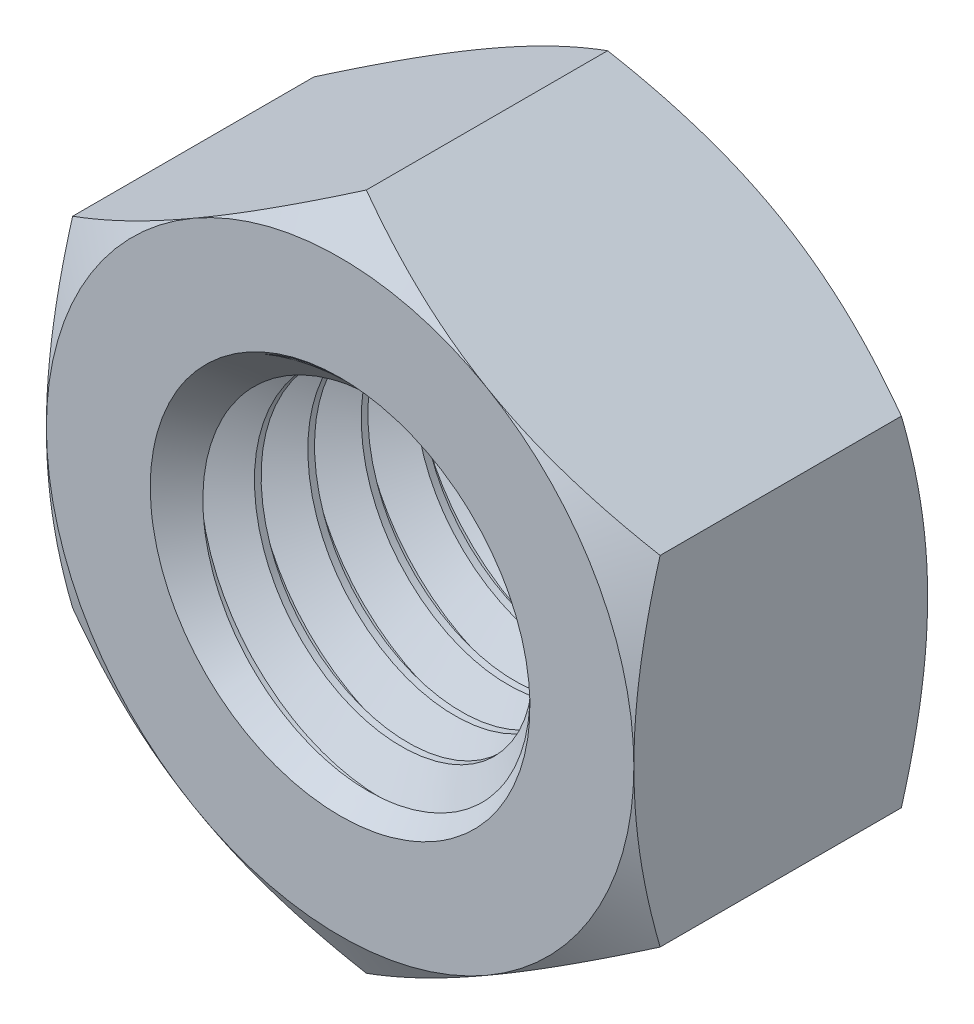
from build123d import *

# Parameters (mm, degrees)
BOSS_EXTRUDE1_DEPTH      = 2.75
BOSS_EXTRUDE1_DEPTH_BACK = 2.75
SKETCH2_R                = 3.5
SKETCH3_OUTSIDE_W        = 54.786
SKETCH3_OUTSIDE_H        = 56.488
SKETCH3_OUTSIDE_R        = 5.5
CUT_EXTRUDE1_DEPTH       = 11.041580221
CUT_EXTRUDE1_DRAFT       = -60
MIRROR1_COPY_1_SKETCH_W  = 54.786
MIRROR1_COPY_1_SKETCH_H  = 56.488
MIRROR1_COPY_1_SKETCH_R  = 5.5
MIRROR1_COPY_1_DEPTH     = 11.041580221
MIRROR1_COPY_1_DRAFT     = -60
SWEEP1_PITCH             = 1
SKETCH6_R                = 3.554126588
CUT_EXTRUDE2_DEPTH       = 11.641454896
SKETCH7_R                = 3.554126588
CUT_EXTRUDE3_DEPTH       = 11.04158033


with BuildPart() as part:
    # Sketch2 → Boss-Extrude1 (new, two sides: drawn at the far end of the back side and taken through both)
    with BuildSketch(Plane.XY.offset(-BOSS_EXTRUDE1_DEPTH_BACK)):
        Polygon((0, 6.350852961), (-5.5, 3.175426481), (-5.5, -3.175426481), (0, -6.350852961), (5.5, -3.175426481), (5.5, 3.175426481), align=None)
        Circle(SKETCH2_R, mode=Mode.SUBTRACT)
    extrude(amount=BOSS_EXTRUDE1_DEPTH + BOSS_EXTRUDE1_DEPTH_BACK)


with BuildPart() as cut_extrude1_tool:
    # Sketch3 outside → Cut-Extrude1 (with draft: the straight prism first)
    with BuildSketch(Plane.XY.offset(2.75)):
        Rectangle(SKETCH3_OUTSIDE_W, SKETCH3_OUTSIDE_H)
        Circle(SKETCH3_OUTSIDE_R, mode=Mode.SUBTRACT)
    extrude(amount=-CUT_EXTRUDE1_DEPTH)
    # Cut-Extrude1: the draft: its side faces are tilted about the plane it starts from
    cut_extrude1_sides = [cut_extrude1_tool.faces().sort_by_distance(p)[0] for p in [
        (0, -28.244, -2.77079011),
        (27.393, 0, -2.77079011),
        (0, 28.244, -2.77079011),
        (-27.393, 0, -2.77079011),
        (-5.5, 0, -2.77079011),
    ]]
    draft(cut_extrude1_sides, Plane.XY.offset(2.75), CUT_EXTRUDE1_DRAFT)


with BuildPart() as part_1:
    add(part.part)

    # Cut-Extrude1: cut by cut_extrude1_tool
    add(cut_extrude1_tool.part, mode=Mode.SUBTRACT)


with BuildPart() as mirror1_copy_1_tool:
    # Mirror1 copy 1 sketch → Mirror1 copy 1 (with draft: the straight prism first)
    with BuildSketch(Plane(origin=(0, 0, -2.75), x_dir=(1, 0, 0), z_dir=(0, 0, -1))):
        Rectangle(MIRROR1_COPY_1_SKETCH_W, MIRROR1_COPY_1_SKETCH_H)
        Circle(MIRROR1_COPY_1_SKETCH_R, mode=Mode.SUBTRACT)
    extrude(amount=-MIRROR1_COPY_1_DEPTH)
    # Mirror1 copy 1: the draft: its side faces are tilted about the plane it starts from
    mirror1_copy_1_sides = [mirror1_copy_1_tool.faces().sort_by_distance(p)[0] for p in [
        (0, -28.244, 2.77079011),
        (27.393, 0, 2.77079011),
        (0, 28.244, 2.77079011),
        (-27.393, 0, 2.77079011),
        (-5.5, 0, 2.77079011),
    ]]
    draft(mirror1_copy_1_sides, Plane(origin=(0, 0, -2.75), x_dir=(1, 0, 0), z_dir=(0, 0, -1)), MIRROR1_COPY_1_DRAFT)


with BuildPart() as part_2:
    add(part_1.part)

    # Mirror1 copy 1: cut by mirror1_copy_1_tool
    add(mirror1_copy_1_tool.part, mode=Mode.SUBTRACT)

    # Sweep1: arcs per turn and ends read off the stored shape
    # Sweep1: the profile of Sketch4 screwed along a right-hand helix through 6.5 turns, 8 arcs to a turn; built about Z, then put on its axis
    sweep1_z = Axis((0, 0, 0), (0, 0, 1))
    sweep1_corners = [(3.554126588, 0, -0.90625), (2.850480947, 0, -0.5), (2.850480947, 0, -0.375), (3.554126588, 0, 0.03125)]
    with BuildLine(mode=Mode.PRIVATE) as sweep1_profile:
        Line(sweep1_corners[0], sweep1_corners[1])
        Line(sweep1_corners[1], sweep1_corners[2])
        Line(sweep1_corners[2], sweep1_corners[3])
        Line(sweep1_corners[3], sweep1_corners[0])
    sweep1_cap = Face(sweep1_profile.wire())
    sweep1_turn_angles = [0, 22.5, 45, 67.5, 90, 112.5, 135, 157.5, 180, 202.5, 225, 247.5, 270, 292.5, 315, 337.5, 360]
    sweep1_turn_weights = [1, 0.9238795325112867, 1, 0.9238795325112867, 1, 0.9238795325112867, 1, 0.9238795325112867, 1, 0.9238795325112867, 1, 0.9238795325112867, 1, 0.9238795325112867, 1, 0.9238795325112867, 1]
    sweep1_turn_rails = [Edge.make_bspline([Vector(p[0], p[1], 0).rotate(sweep1_z, sweep1_turn_angles[k]) / sweep1_turn_weights[k] + Vector(0, 0, p[2] + SWEEP1_PITCH * sweep1_turn_angles[k] / 360) for k in range(17)], [0, 0, 0, 1, 1, 2, 2, 3, 3, 4, 4, 5, 5, 6, 6, 7, 7, 8, 8, 8], 2, sweep1_turn_weights) for p in sweep1_corners]
    sweep1_turn_sides = [Face.make_surface_from_curves(sweep1_turn_rails[p[0]], sweep1_turn_rails[p[1]]) for p in [(0, 1), (1, 2), (2, 3), (3, 0)]]
    sweep1_last_angles = [2160, 2182.5, 2205, 2227.5, 2250, 2272.5, 2295, 2317.5, 2340]
    sweep1_last_weights = [1, 0.9238795325112867, 1, 0.9238795325112867, 1, 0.9238795325112867, 1, 0.9238795325112062, 1]
    sweep1_last_rails = [Edge.make_bspline([Vector(p[0], p[1], 0).rotate(sweep1_z, sweep1_last_angles[k]) / sweep1_last_weights[k] + Vector(0, 0, p[2] + SWEEP1_PITCH * sweep1_last_angles[k] / 360) for k in range(9)], [0, 0, 0, 1, 1, 2, 2, 3, 3, 4, 4, 4], 2, sweep1_last_weights) for p in sweep1_corners]
    sweep1_last_sides = [Face.make_surface_from_curves(sweep1_last_rails[p[0]], sweep1_last_rails[p[1]]) for p in [(0, 1), (1, 2), (2, 3), (3, 0)]]
    sweep1 = Plane(origin=(0, 0, 2.75), x_dir=(0, 1, 0), z_dir=(0, 0, -1)) * Solid(Shell([*[p.moved(Location((0, 0, SWEEP1_PITCH * i))) for i in range(6) for p in sweep1_turn_sides], *sweep1_last_sides, sweep1_cap, sweep1_cap.rotate(sweep1_z, 2340).moved(Location((0, 0, SWEEP1_PITCH * 2340 / 360)))]))
    add(sweep1)

    # Sketch6 → Cut-Extrude2 (cut)
    with BuildSketch(Plane.XY.offset(2.75)):
        Circle(SKETCH6_R)
    extrude(amount=CUT_EXTRUDE2_DEPTH, mode=Mode.SUBTRACT)

    # Cut-Extrude2 cone 1 section (through the dimple's axis) → Cut-Extrude2 other way (revolve, cut)
    with BuildSketch(Plane(origin=(0, 0, 2.75), x_dir=(0, -1, 0), z_dir=(1, 0, 0))):
        Polygon((0, 0), (3.554126588, 0), (0, 3.554126588), align=None)
    revolve(axis=Axis((0, 0, 2.75), (0, 0, -1)), mode=Mode.SUBTRACT)

    # Sketch7 → Cut-Extrude3 (cut)
    with BuildSketch(Plane(origin=(0, 0, -2.75), x_dir=(-1, 0, 0), z_dir=(0, 0, -1))):
        Circle(SKETCH7_R)
    extrude(amount=CUT_EXTRUDE3_DEPTH, mode=Mode.SUBTRACT)

    # Cut-Extrude3 cone 1 section (through the dimple's axis) → Cut-Extrude3 other way (revolve, cut)
    with BuildSketch(Plane(origin=(0, 0, -2.75), x_dir=(0, 1, 0), z_dir=(1, 0, 0))):
        Polygon((0, 0), (3.554126588, 0), (0, 3.554126588), align=None)
    revolve(axis=Axis((0, 0, -2.75), (0, 0, 1)), mode=Mode.SUBTRACT)


solid = part_2.part
